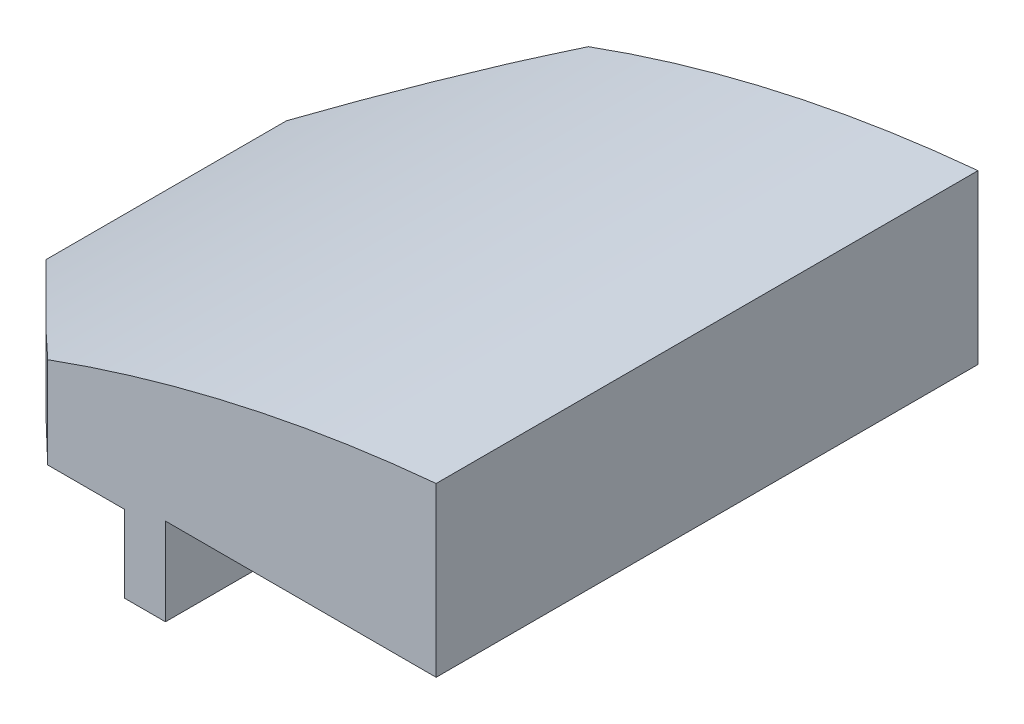
from build123d import *
from build123d.topology import SkipClean

# Parameters (mm, degrees)
BOSS_EXTRUDE1_DEPTH      = 3.95
SHELL1_T                 = -1.2
SKETCH3_W                = 6.823927471
SKETCH3_H                = 5.581929969
CUT_EXTRUDE1_DEPTH       = 2.4
BOSS_EXTRUDE3_REACH      = 14.559
BOSS_EXTRUDE3_END_RADIUS = 43.712775366
BOSS_EXTRUDE3_START      = -1.8
SKETCH4_R                = 2.4
SKETCH4_R_2              = 1.9
CUT_EXTRUDE4_REACH       = 13.553
BOSS_EXTRUDE4_START      = -3.51
BOSS_EXTRUDE4_DEPTH      = 3.51
SHELL2_START             = 3.540892579
SHELL2_OUTLINE_W         = 7.9
SHELL2_OUTLINE_H         = 6.98035738
SHELL2_DEPTH             = 3.609652258
SHELL2_START_2           = 1.037208095
SHELL2_2_DEPTH           = 4.401988613
SHELL2_START_3           = -10.97
SHELL2_3_DEPTH           = 7.02
SHELL2_4_DEPTH           = 7.02
CUT_EXTRUDE5_DEPTH       = 22.359542769
SKETCH16_W               = 22.82
SKETCH16_H               = 1.2435468
CUT_EXTRUDE10_DEPTH      = 7.9
SKETCH17_W               = 3.486934667
SKETCH17_H               = 7.447231284
SKETCH17_W_2             = 3.517769968
CUT_EXTRUDE11_DEPTH      = 27.03272194
CUT_EXTRUDE12_DEPTH      = 18.123431779
CUT_EXTRUDE13_DEPTH      = 20.609163221
BOSS_EXTRUDE5_DEPTH      = 1.2
SKETCH23_W               = 3.213065333
SKETCH23_H               = 2.258477707
SKETCH23_W_2             = 3.182230032
BOSS_EXTRUDE6_DEPTH      = 1.2
BOSS_EXTRUDE7_START      = -1.2
BOSS_EXTRUDE7_DEPTH      = 1.2
CUT_EXTRUDE14_DEPTH      = 19.031936029


with BuildPart() as part:
    # Sketch1 → Boss-Extrude1 (new, symmetric)
    with BuildSketch(Plane.XY):
        with BuildLine():
            Line((7.9, 8.484439379), (7.9, 5.540892579))
            Line((7.9, 5.540892579), (7.9, 2.340892579))
            Line((7.9, 2.340892579), (0, 2.340892579))
            Line((0, 2.340892579), (0, 1.037208095))
            Line((0, 1.037208095), (-7.9, 1.037208095))
            Line((-7.9, 1.037208095), (-7.9, 4.036739959))
            ThreePointArc((-7.9, 4.036739959), (-0.204910293, 6.988512651), (7.9, 8.484439379))
        make_face()
    extrude(amount=BOSS_EXTRUDE1_DEPTH, both=True)

    # Shell1
    shell1_openings = [part.faces().sort_by_distance(p)[0] for p in [
        (-3.95, 1.037208095, 0),
    ]]
    offset(amount=SHELL1_T, openings=shell1_openings, kind=Kind.INTERSECTION)

    # Sketch3 → Cut-Extrude1 (cut)
    with BuildSketch(Plane.XZ.offset(-2.340892579)):
        with Locations((3.411963736, 0.021143674)):
            Rectangle(SKETCH3_W, SKETCH3_H)
    extrude(amount=-CUT_EXTRUDE1_DEPTH, mode=Mode.SUBTRACT)

    # Boss-Extrude3: up to this cylinder (the profile starts inside it)
    boss_extrude3_end = Plane(origin=(11.965039047, -36.243995073, 2.332118), z_dir=(0, 0, -1)) * Cylinder(BOSS_EXTRUDE3_END_RADIUS, 117.543550731, mode=Mode.PRIVATE)
    # Sketch4 → Boss-Extrude3 (add, up to the surface)
    with BuildSketch(Plane(origin=(0, 2.340892579, 0), x_dir=(-1, 0, 0), z_dir=(0, -1, 0)).offset(BOSS_EXTRUDE3_START), mode=Mode.PRIVATE) as boss_extrude3_sk1:
        with Locations(Location((-3.411963735, 0, 0), (0, 0, 90))):
            Circle(SKETCH4_R)
        with Locations(Location((-3.411963735, 0, 0), (0, 0, 90))):
            Circle(SKETCH4_R_2, mode=Mode.SUBTRACT)
    boss_extrude3_tool1 = extrude(boss_extrude3_sk1.sketch, amount=-BOSS_EXTRUDE3_REACH, mode=Mode.PRIVATE) & boss_extrude3_end
    add(boss_extrude3_tool1.solids().sort_by_distance((3.411964, 4.140893, 2.332118))[0])

    # Sketch7 → Cut-Extrude4 (cut, up to next)
    with BuildSketch(Plane(origin=(0, 1.037208095, 0), x_dir=(-1, 0, 0), z_dir=(0, -1, 0)), mode=Mode.PRIVATE) as cut_extrude4_sk1:
        Polygon((7.9, 3.95), (0, -3.95), (7.9, -3.95), align=None)
    cut_extrude4_tool1 = extrude(cut_extrude4_sk1.sketch, amount=-CUT_EXTRUDE4_REACH, mode=Mode.PRIVATE) & part.part
    add(cut_extrude4_tool1.solids().sort_by_distance((-5.266667, 1.037208, 1.316667))[0], mode=Mode.SUBTRACT)

    # Sketch8 → Boss-Extrude4 (add)
    with BuildSketch(Plane(origin=(0, 0, -7.46), x_dir=(-1, 0, 0), z_dir=(0, 0, -1)).offset(BOSS_EXTRUDE4_START)):
        with BuildLine():
            Line((-7.9, 7.189017048), (-7.9, 2.340892579))
            Line((-7.9, 2.340892579), (0, 2.340892579))
            Line((0, 2.340892579), (0, 1.037208095))
            Line((0, 1.037208095), (7.9, 1.037208095))
            Line((7.9, 1.037208095), (7.9, 4.036739959))
            ThreePointArc((7.9, 4.036739959), (0.204910293, 6.988512651), (-7.9, 8.484439379))
            Line((-7.9, 8.484439379), (-7.9, 7.189017048))
        make_face()
    extrude(amount=BOSS_EXTRUDE4_DEPTH)

    # Mirror1: part across plane


with BuildPart() as part_1:
    add(part.part)
    add(part.part.mirror(Plane(origin=(0, 0, -7.46), x_dir=(1, 0, 0), z_dir=(0, 0, -1))))

    # Shell2: read off the stored shape, not the designer's step
    # Shell2 outline → Shell2 (cut)
    with BuildSketch(Plane(origin=(0, 0, 0), x_dir=(1, 0, 0), z_dir=(0, 1, 0)).offset(SHELL2_START)):
        with Locations((2.75, 7.46)):
            Rectangle(SHELL2_OUTLINE_W, SHELL2_OUTLINE_H)
    extrude(amount=SHELL2_DEPTH, mode=Mode.SUBTRACT)

    # Shell2 2 outline → Shell2 2 (cut)
    with BuildSketch(Plane(origin=(0, 0, 0), x_dir=(1, 0, 0), z_dir=(0, 1, 0)).offset(SHELL2_START_2)):
        Polygon((-1.2, 3.95), (-1.2, 10.97), (-6.202943725, 10.97), (-6.7, 10.472943725), (-6.7, 4.447056275), (-6.202943725, 3.95), align=None)
    extrude(amount=SHELL2_2_DEPTH, mode=Mode.SUBTRACT)

    # Shell2 3 outline → Shell2 3 (cut)
    with BuildSketch(Plane.XY.offset(SHELL2_START_3)):
        with BuildLine():
            ThreePointArc((6.7, 7.150544837), (3.582625992, 6.65754198), (0.508949666, 5.940892579))
            Line((0.508949666, 5.940892579), (6.7, 5.940892579))
            Line((6.7, 5.940892579), (6.7, 7.150544837))
        make_face()
    extrude(amount=SHELL2_3_DEPTH, mode=Mode.SUBTRACT)

    # Shell2 4 outline → Shell2 4 (add)
    with SkipClean():  # the faces are left unmerged after this step: merging them gives an invalid solid
        with BuildSketch(Plane.XY.offset(SHELL2_START_3)):
            with BuildLine():
                ThreePointArc((-4.75826547, 5.439196708), (-5.7340289, 5.034333198), (-6.7, 4.606631708))
                Line((-6.7, 4.606631708), (-6.7, 3.283502287))
                ThreePointArc((-6.7, 3.283502287), (-3.986456885, 4.454364939), (-1.2, 5.439196708))
                Line((-1.2, 5.439196708), (-4.75826547, 5.439196708))
            make_face()
            with BuildLine():
                ThreePointArc((0.386122992, 7.150544837), (-0.40902625, 6.930533287), (-1.2, 6.69595297))
                Line((-1.2, 6.69595297), (-1.2, 5.439196708))
                ThreePointArc((-1.2, 5.439196708), (2.710357921, 6.477868269), (6.7, 7.150544837))
                Line((6.7, 7.150544837), (0.386122992, 7.150544837))
            make_face()
        extrude(amount=SHELL2_4_DEPTH)
    add(part_1.part.scale(1), mode=Mode.REPLACE)  # the faces are merged on a copy

    # Sketch10 → Cut-Extrude5 (cut, through all)
    with BuildSketch(Plane(origin=(0, 2.340892579, 0), x_dir=(-1, 0, 0), z_dir=(0, -1, 0))):
        Polygon((1.2, 12.17), (1.2, 10.97), (6.202943725, 10.97), (6.7, 10.472943725), (7.9, 10.97), (6.7, 12.17), align=None)
        Polygon((1.2, 2.75), (6.7, 2.75), (7.9, 3.95), (6.7, 4.447056275), (6.202943725, 3.95), (1.2, 3.95), align=None)
    extrude(amount=CUT_EXTRUDE5_DEPTH, mode=Mode.SUBTRACT)

    # Sketch16 → Cut-Extrude10 (cut)
    with BuildSketch(Plane(origin=(7.9, 0, 0), x_dir=(0, 0, -1), z_dir=(1, 0, 0))):
        with Locations((7.46, 2.962665979)):
            Rectangle(SKETCH16_W, SKETCH16_H)
    extrude(amount=-CUT_EXTRUDE10_DEPTH, mode=Mode.SUBTRACT)

    # Sketch17 → Cut-Extrude11 (cut, through all)
    with BuildSketch(Plane(origin=(7.9, 0, 0), x_dir=(0, 0, -1), z_dir=(1.0, -1.5823538232397524e-12, 0))):
        with Locations((-2.206532667, 4.760823737)):
            Rectangle(SKETCH17_W, SKETCH17_H)
        with Locations((17.111115016, 4.760823737)):
            Rectangle(SKETCH17_W_2, SKETCH17_H)
    extrude(amount=-CUT_EXTRUDE11_DEPTH, mode=Mode.SUBTRACT)

    # Sketch18 → Cut-Extrude12 (cut, through all)
    with BuildSketch(Plane.XY.offset(-2.75)):
        with BuildLine():
            Line((-1.2, 2.340892579), (-6.7, 2.340892579))
            Line((-6.7, 2.340892579), (-6.7, 3.283502287))
            ThreePointArc((-6.7, 3.283502287), (-3.986456885, 4.454364939), (-1.2, 5.439196708))
            Line((-1.2, 5.439196708), (-1.2, 3.540892579))
            Line((-1.2, 3.540892579), (-1.2, 2.340892579))
        make_face()
    extrude(amount=-CUT_EXTRUDE12_DEPTH, mode=Mode.SUBTRACT)

    # Sketch19 → Cut-Extrude13 (cut, through all)
    with BuildSketch(Plane.XY.offset(0.463065333)):
        with BuildLine():
            Line((0, 5.799370286), (0, 3.540892579))
            Line((0, 3.540892579), (6.823927471, 3.584439379))
            Line((6.823927471, 3.584439379), (6.823927471, 7.181547539))
            ThreePointArc((6.823927471, 7.181547539), (3.39019483, 6.597933861), (0, 5.799370286))
        make_face()
    extrude(amount=-CUT_EXTRUDE13_DEPTH, mode=Mode.SUBTRACT)

    # Sketch20 → Boss-Extrude5 (add)
    with BuildSketch(Plane(origin=(0, 0, 0), x_dir=(0, 0, -1), z_dir=(1, 0, 0))):
        Polygon((3.96982131, 3.540892579), (3.953429775, 6.436658409), (10.966345521, 6.396961672), (10.95017869, 3.540892579), align=None)
    extrude(amount=-BOSS_EXTRUDE5_DEPTH)

    # Sketch23 → Boss-Extrude6 (add)
    with BuildSketch(Plane(origin=(0, 0, 0), x_dir=(0, 0, -1), z_dir=(1, 0, 0))):
        with Locations((1.143467334, 4.670131432)):
            Rectangle(SKETCH23_W, SKETCH23_H)
        with Locations((13.761115016, 4.670131432)):
            Rectangle(SKETCH23_W_2, SKETCH23_H)
    extrude(amount=-BOSS_EXTRUDE6_DEPTH)

    # Sketch25 → Boss-Extrude7 (add)
    with BuildSketch(Plane.XY.offset(0.463065333).offset(BOSS_EXTRUDE7_START)):
        with BuildLine():
            Line((6.823927471, 3.584439379), (6.823927471, 7.181547539))
            ThreePointArc((6.823927471, 7.181547539), (3.384337724, 6.626850897), (0, 5.799370286))
            Line((0, 5.799370286), (0, 3.584439379))
            Line((0, 3.584439379), (6.823927471, 3.584439379))
        make_face()
        with BuildLine():
            Line((-6.7, 3.283502287), (-1.2, 3.283502287))
            Line((-1.2, 3.283502287), (-1.2, 5.439196708))
            ThreePointArc((-1.2, 5.439196708), (-3.986456885, 4.454364939), (-6.7, 3.283502287))
        make_face()
    boss_extrude7 = extrude(amount=BOSS_EXTRUDE7_DEPTH)

    # Sketch28 → Cut-Extrude14 (cut, through all)
    with BuildSketch(Plane.XZ.offset(-3.283502287)):
        Polygon((-4.686934667, -0.736934667), (-3.437061956, 0.463065333), (-6.7, 0.463065333), (-6.7, -0.736934667), align=None)
    cut_extrude14 = extrude(amount=-CUT_EXTRUDE14_DEPTH, mode=Mode.SUBTRACT)

    # Mirror2: Boss-Extrude7, Cut-Extrude14 across plane
    add(boss_extrude7.mirror(Plane(origin=(0, 0, -7.46), x_dir=(1, 0, 0), z_dir=(0, 0, -1))))
    add(cut_extrude14.mirror(Plane(origin=(0, 0, -7.46), x_dir=(1, 0, 0), z_dir=(0, 0, -1))), mode=Mode.SUBTRACT)


solid = part_1.part
